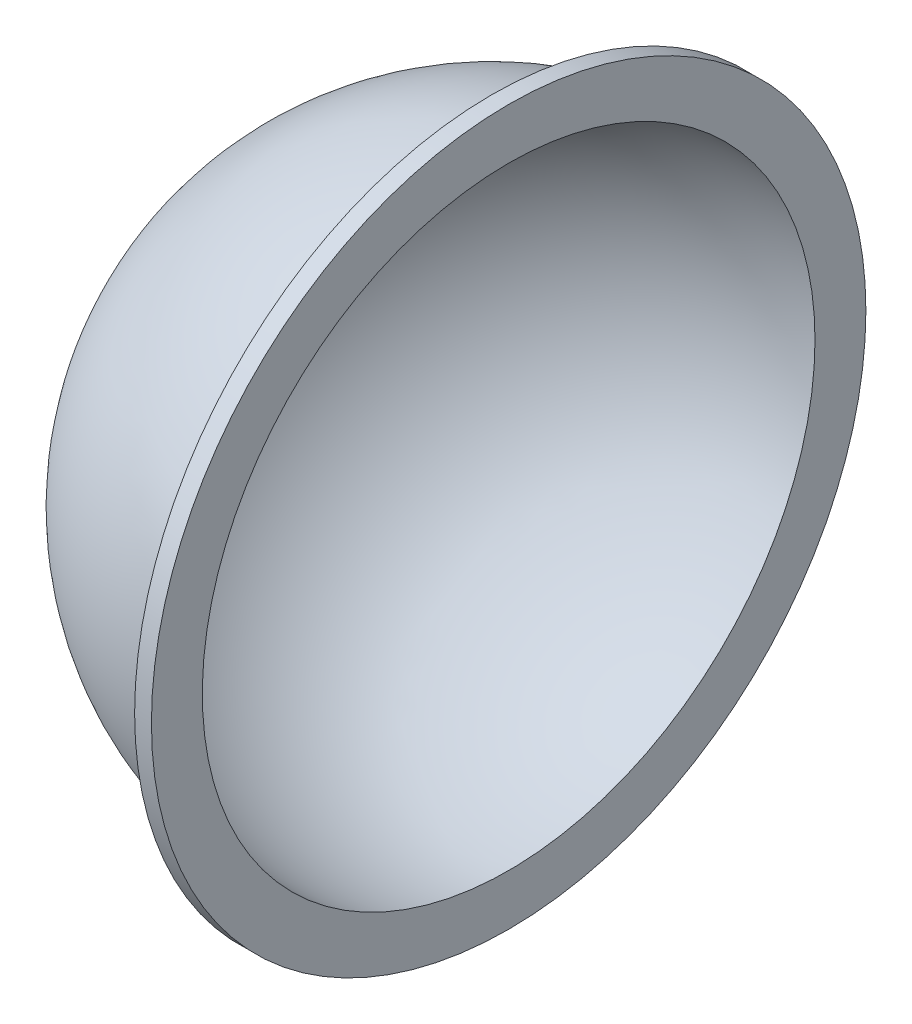
from build123d import *


with BuildPart() as part:
    # Sketch1 → Revolve1 (revolve)
    with BuildSketch(Plane.XY):
        with BuildLine():
            ThreePointArc((-36.5, 0), (-25.092329505, 26.507074527), (2, 36.445164288))
            Line((2, 36.445164288), (2, 42.5))
            Line((2, 42.5), (0, 42.5))
            Line((0, 42.5), (0, 37.5))
            ThreePointArc((0, 37.5), (-26.516504294, 26.516504294), (-37.5, 0))
            Line((-37.5, 0), (-36.5, 0))
        make_face()
    revolve(axis=Axis((0, 0, 0), (-1, 0, 0)))


solid = part.part
